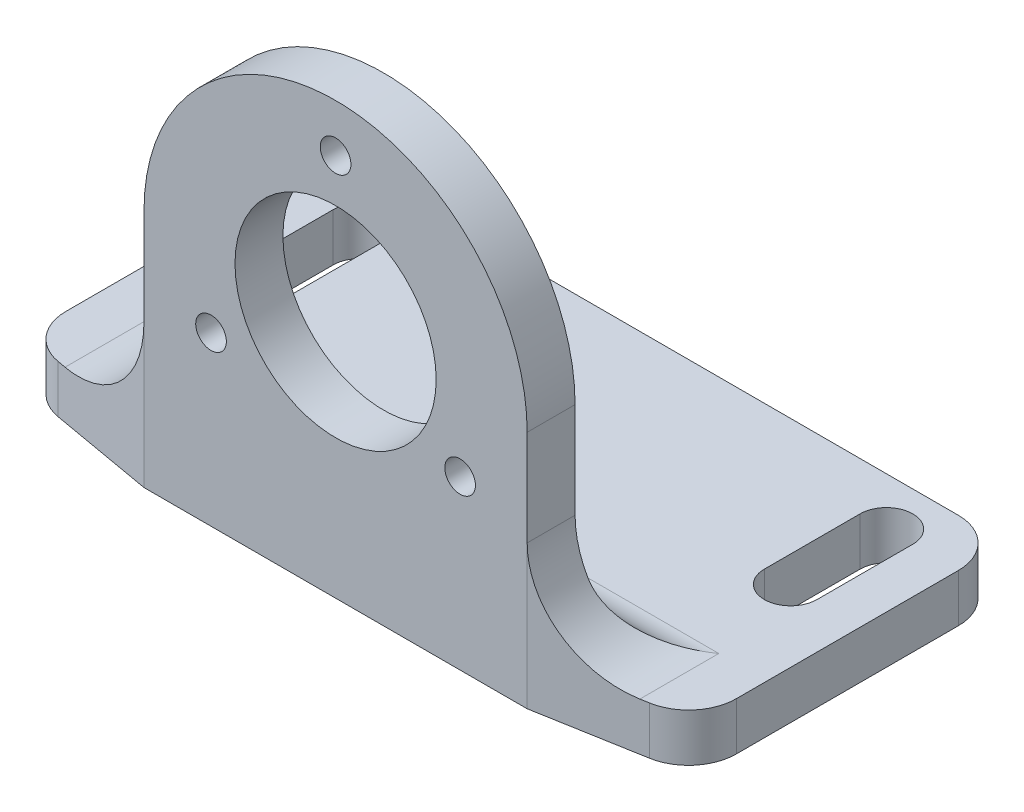
from build123d import *

# Parameters (mm, degrees)
SKETCH1_W           = 40
SKETCH1_H           = 30
BOSS_EXTRUDE1_DEPTH = 5
BOSS_EXTRUDE2_DEPTH = 5
SKETCH4_R           = 10.5
SKETCH4_R_2         = 1.6
CUT_EXTRUDE2_DEPTH  = 5
SKETCH5_W           = 15
SKETCH5_H           = 30
BOSS_EXTRUDE3_DEPTH = 5
CHAMFER1_SIZE       = 5
CHAMFER1_SIZE_2     = 28.356409098
CHAMFER2_SIZE       = 5
CHAMFER2_SIZE_2     = 28.356409098
FILLET1_R           = 10
FILLET2_R           = 5
FILLET4_R           = 5
CUT_EXTRUDE3_DEPTH  = 78.136243103


with BuildPart() as part:
    # Sketch1 → Boss-Extrude1 (new body)
    with BuildSketch(Plane(origin=(0, 0, 0), x_dir=(1, 0, 0), z_dir=(0, 1, 0))):
        with Locations((20, 15)):
            Rectangle(SKETCH1_W, SKETCH1_H)
    extrude(amount=BOSS_EXTRUDE1_DEPTH)

    # Sketch2 → Boss-Extrude2 (add)
    with BuildSketch(Plane.XY):
        with BuildLine():
            Line((0, 5), (0, 25))
            ThreePointArc((0, 25), (20, 45), (40, 25))
            Line((40, 25), (40, 5))
            Line((40, 5), (40, 0))
            Line((40, 0), (0, 0))
            Line((0, 0), (0, 5))
        make_face()
    extrude(amount=BOSS_EXTRUDE2_DEPTH)

    # Sketch4 → Cut-Extrude2 (cut)
    with BuildSketch(Plane.XY.offset(5)):
        with Locations((20, 25)):
            Circle(SKETCH4_R)
        with Locations((20, 40.011106999)):
            Circle(SKETCH4_R_2)
        with Locations((7, 17.494446501)):
            Circle(SKETCH4_R_2)
        with Locations((33, 17.494446501)):
            Circle(SKETCH4_R_2)
    extrude(amount=-CUT_EXTRUDE2_DEPTH, mode=Mode.SUBTRACT)

    # Sketch5 → Boss-Extrude3 (add)
    # profile 1 of 2: a face of its own
    with BuildSketch(Plane(origin=(0, 5, 0), x_dir=(1, 0, 0), z_dir=(0, 1, 0))):
        with Locations((-7.5, 15)):
            Rectangle(SKETCH5_W, SKETCH5_H)
        with BuildLine():
            Line((-10.25, 15), (-10.25, 25))
            ThreePointArc((-10.25, 25), (-7.5, 27.75), (-4.75, 25))
            Line((-4.75, 25), (-4.75, 15))
            ThreePointArc((-4.75, 15), (-7.5, 12.25), (-10.25, 15))
        make_face(mode=Mode.SUBTRACT)
    # profile 2 of 2: a face of its own
    with BuildSketch(Plane(origin=(0, 5, 0), x_dir=(1, 0, 0), z_dir=(0, 1, 0))):
        with Locations((47.5, 15)):
            Rectangle(SKETCH5_W, SKETCH5_H)
        with BuildLine():
            Line((50.25, 15), (50.25, 25))
            ThreePointArc((50.25, 25), (47.5, 27.75), (44.75, 25))
            Line((44.75, 25), (44.75, 15))
            ThreePointArc((44.75, 15), (47.5, 12.25), (50.25, 15))
        make_face(mode=Mode.SUBTRACT)
    extrude(amount=-BOSS_EXTRUDE3_DEPTH)

    # Chamfer1
    # the kernel refuses this chamfer: 28.356409098, 5 mm, written as the material it adds along each edge
    with BuildSketch(Plane(origin=(0, 5, 0), x_dir=(0.21013876076743523, 0, 0.9776715712462578), z_dir=(0, -1, 0))) as chamfer1_piece_1_section:
        Polygon((CHAMFER1_SIZE * 0.977671571246, CHAMFER1_SIZE * 0.210138760767), (-CHAMFER1_SIZE_2 * 0.210138760768, CHAMFER1_SIZE_2 * 0.977671571249), (0, 0), align=None)
    chamfer1_piece_1 = extrude(amount=5, mode=Mode.PRIVATE)
    chamfer1_piece_1 = split(chamfer1_piece_1, bisect_by=Plane(origin=(-6.173112567, 2.5, 5), z_dir=(0, 0, -1)), keep=Keep.TOP, mode=Mode.PRIVATE)
    chamfer1_piece_1 = split(chamfer1_piece_1, bisect_by=Plane(origin=(-15, 2.5, 1.987176297), z_dir=(1, 0, 0)), keep=Keep.TOP, mode=Mode.PRIVATE)
    add(chamfer1_piece_1)

    # Chamfer2
    # the kernel refuses this chamfer: 28.356409098, 5 mm, written as the material it adds along each edge
    with BuildSketch(Plane(origin=(40, 5, 0), x_dir=(-0.2101387607674354, 0, 0.9776715712462578), z_dir=(0, -1, 0))) as chamfer2_piece_1_section:
        Polygon((CHAMFER2_SIZE * 0.977671571246, -CHAMFER2_SIZE * 0.210138760767), (-CHAMFER2_SIZE_2 * 0.210138760768, -CHAMFER2_SIZE_2 * 0.977671571249), (0, 0), align=None)
    chamfer2_piece_1 = extrude(amount=5, mode=Mode.PRIVATE)
    chamfer2_piece_1 = split(chamfer2_piece_1, bisect_by=Plane(origin=(46.173112567, 2.5, 5), z_dir=(0, 0, -1)), keep=Keep.TOP, mode=Mode.PRIVATE)
    chamfer2_piece_1 = split(chamfer2_piece_1, bisect_by=Plane(origin=(55, 2.5, 1.987176297), z_dir=(-1, 0, 0)), keep=Keep.TOP, mode=Mode.PRIVATE)
    add(chamfer2_piece_1)

    # Fillet1
    fillet1_edges = [part.edges().sort_by_distance(p)[0] for p in [
        (40, 5, 2.5),
        (0, 5, 2.5),
    ]]
    fillet(fillet1_edges, radius=FILLET1_R)

    # Fillet2
    fillet2_edges = [part.edges().sort_by_distance(p)[0] for p in [
        (55, 2.5, 2.355095289),
        (-15, 2.5, -30),
        (55, 2.5, -30),
        (-15, 2.5, 2.355095289),
    ]]
    fillet(fillet2_edges, radius=FILLET2_R)

    # Fillet4
    fillet4_edges = [part.edges().sort_by_distance(p)[0] for p in [
        (20, 5, 0),
    ]]
    fillet(fillet4_edges, radius=FILLET4_R)

    # Sketch6 → Cut-Extrude3 (cut, through all)
    with BuildSketch(Plane(origin=(0, 0, 0), x_dir=(-1, 0, 0), z_dir=(0, 0, -1))):
        with BuildLine():
            Line((-25.611038109, 5), (-14.388961891, 5))
            ThreePointArc((-14.388961891, 5), (-3.752498092, 12.523671995), (0, 25))
            ThreePointArc((0, 25), (-20, 45), (-40, 25))
            ThreePointArc((-40, 25), (-36.247501908, 12.523671995), (-25.611038109, 5))
        make_face()
    extrude(amount=CUT_EXTRUDE3_DEPTH, mode=Mode.SUBTRACT)


solid = part.part
